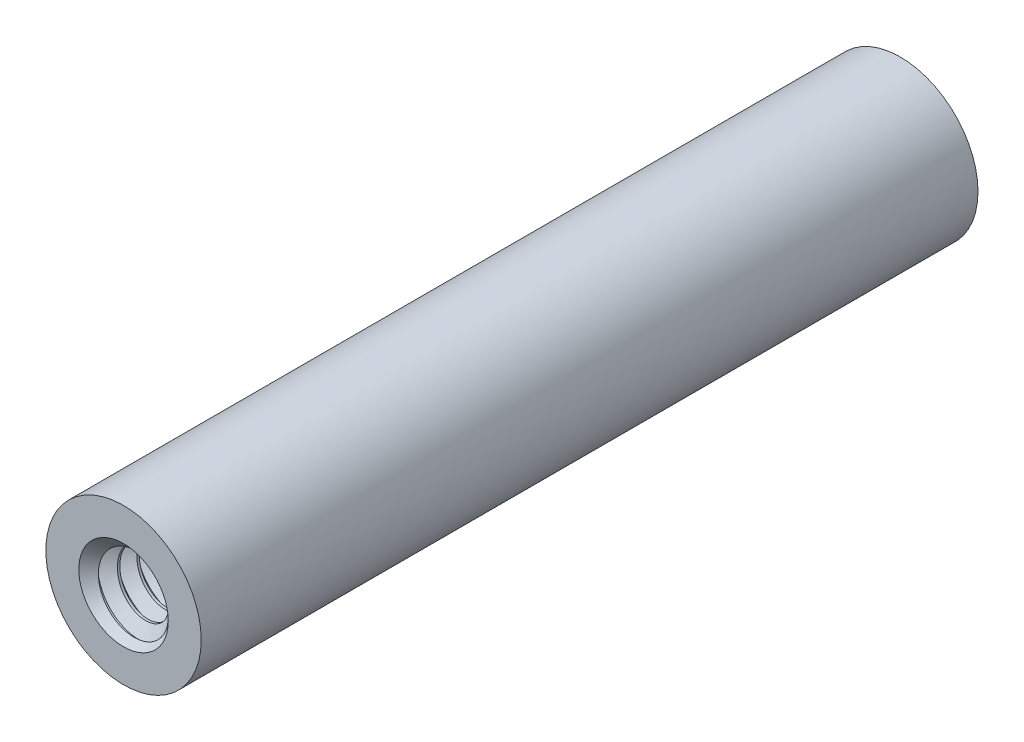
from build123d import *

# Parameters (mm, degrees)
BOSS_EXTRUDE1_START = 15.875
SKETCH13_R          = 1.7526
BOSS_EXTRUDE1_DEPTH = 9.525
CUT_SWEEP1_PITCH    = 0.79375
CIRPATTERN1_COUNT   = 2
CIRPATTERN1_ANGLE   = 180
EXTRUDE1_DEPTH      = 15.875
EXTRUDE1_DEPTH_BACK = 15.875
SKETCH1_R           = 3.175


with BuildPart() as part:
    # Sketch13 → Boss-Extrude1 (new body)
    with BuildSketch(Plane.XY.offset(BOSS_EXTRUDE1_START)):
        Circle(SKETCH13_R)
    extrude(amount=-BOSS_EXTRUDE1_DEPTH)

    # Cut-Sweep1: the profile of Sketch15 profile screwed along a right-hand helix of 13 turns, 8 arcs to a turn; built about Z, then put on its axis
    cut_sweep1_z = Axis((0, 0, 0), (0, 0, 1))
    cut_sweep1_corners = [(1.7529, 0, -0.694704455), (1.7529, 0, 0.000173205), (1.237044252, 0, -0.29765625), (1.237044252, 0, -0.396875)]
    with BuildLine(mode=Mode.PRIVATE) as cut_sweep1_profile:
        Line(cut_sweep1_corners[0], cut_sweep1_corners[1])
        Line(cut_sweep1_corners[1], cut_sweep1_corners[2])
        Line(cut_sweep1_corners[2], cut_sweep1_corners[3])
        Line(cut_sweep1_corners[3], cut_sweep1_corners[0])
    cut_sweep1_cap = Face(cut_sweep1_profile.wire())
    cut_sweep1_turn_angles = [0, 22.5, 45, 67.5, 90, 112.5, 135, 157.5, 180, 202.5, 225, 247.5, 270, 292.5, 315, 337.5, 360]
    cut_sweep1_turn_weights = [1, 0.9238795325112867, 1, 0.9238795325112867, 1, 0.9238795325112867, 1, 0.9238795325112867, 1, 0.9238795325112867, 1, 0.9238795325112867, 1, 0.9238795325112867, 1, 0.9238795325112867, 1]
    cut_sweep1_turn_rails = [Edge.make_bspline([Vector(p[0], p[1], 0).rotate(cut_sweep1_z, cut_sweep1_turn_angles[k]) / cut_sweep1_turn_weights[k] + Vector(0, 0, p[2] + CUT_SWEEP1_PITCH * cut_sweep1_turn_angles[k] / 360) for k in range(17)], [0, 0, 0, 1, 1, 2, 2, 3, 3, 4, 4, 5, 5, 6, 6, 7, 7, 8, 8, 8], 2, cut_sweep1_turn_weights) for p in cut_sweep1_corners]
    cut_sweep1_turn_sides = [Face.make_surface_from_curves(cut_sweep1_turn_rails[p[0]], cut_sweep1_turn_rails[p[1]]) for p in [(0, 1), (1, 2), (2, 3), (3, 0)]]
    cut_sweep1 = Plane(origin=(0, 0, 15.875), x_dir=(0, 1, 0), z_dir=(0, 0, -1)) * Solid(Shell([*[p.moved(Location((0, 0, CUT_SWEEP1_PITCH * i))) for i in range(13) for p in cut_sweep1_turn_sides], cut_sweep1_cap, cut_sweep1_cap.rotate(cut_sweep1_z, 4680).moved(Location((0, 0, CUT_SWEEP1_PITCH * 4680 / 360)))]))
    add(cut_sweep1, mode=Mode.SUBTRACT)

    # Boss-Extrude2 cone 1 section (through the dimple's axis) → Boss-Extrude2 (revolve)
    with BuildSketch(Plane(origin=(0, 0, 15.875), x_dir=(0, -1, 0), z_dir=(1, 0, 0))):
        Polygon((0, 0), (1.8288, 0), (0, 1.8288), align=None)
    revolve(axis=Axis((0, 0, 15.875), (0, 0, -1)))


with BuildPart() as cirpattern1_1:
    # CirPattern1: pattern copy
    add(part.part.rotate(Axis((0, 3.175, 0), (0, -1, 0)), 1 * CIRPATTERN1_ANGLE / (CIRPATTERN1_COUNT - 1)))


with BuildPart() as body_3:
    # Sketch1 → Extrude1 (new, two sides: drawn at the far end of the back side and taken through both)
    with BuildSketch(Plane.XY.offset(-EXTRUDE1_DEPTH_BACK)):
        Circle(SKETCH1_R)
    extrude(amount=EXTRUDE1_DEPTH + EXTRUDE1_DEPTH_BACK)

    # Combine1: cut CirPattern1_1, part
    add(cirpattern1_1.part, mode=Mode.SUBTRACT)
    add(part.part, mode=Mode.SUBTRACT)


solid = body_3.part
